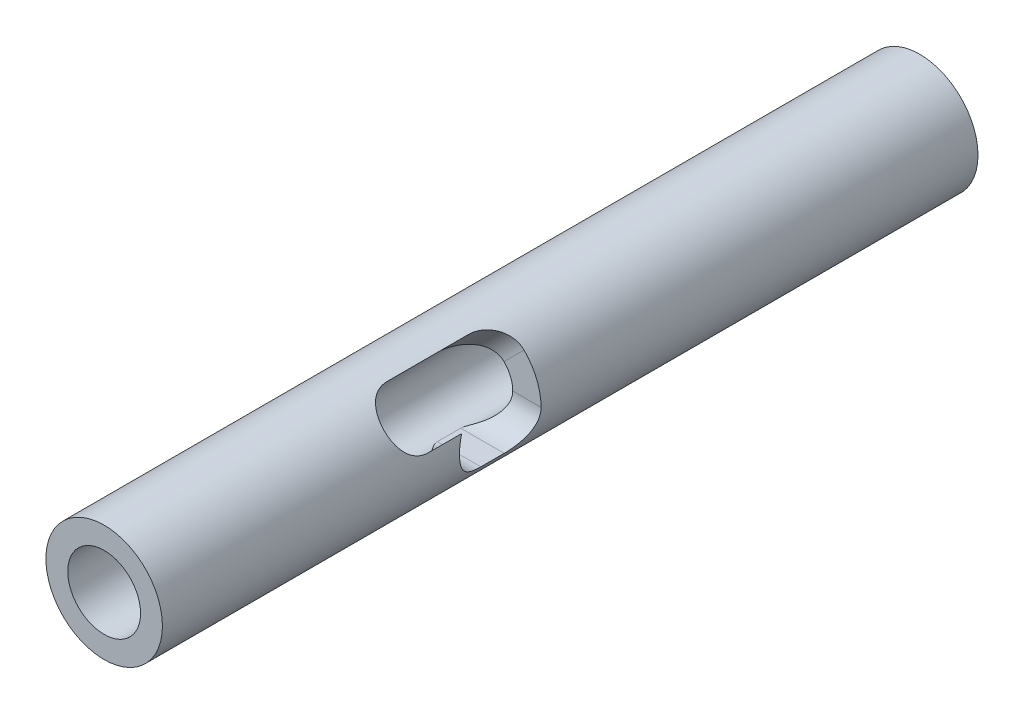
from build123d import *

# Parameters (mm, degrees)
SKETCH1_R           = 6.35
SKETCH1_R_2         = 3.2639
BOSS_EXTRUDE1_DEPTH = 88.9
CUT_EXTRUDE2_DEPTH  = 90.352420225
CUT_EXTRUDE3_DEPTH  = 90.352420338
SKETCH75_W          = 6.35
SKETCH75_H          = 6.35
CUT_REVOLVE1_ANGLE  = 45


# Read off the part's stored shape, not the designer's step: 3/8-16 Tapped Hole3
with BuildPart() as part:
    # Sketch1 → Boss-Extrude1 (new body)
    with BuildSketch(Plane.XY):
        Circle(SKETCH1_R)
        Circle(SKETCH1_R_2, mode=Mode.SUBTRACT)
    extrude(amount=BOSS_EXTRUDE1_DEPTH)

    # 3/8-16 Tapped Hole3 outline → 3/8-16 Tapped Hole3 (revolve, cut)
    with BuildSketch(Plane.XZ):
        Polygon((3.2639, 88.9), (3.2639, 69.426483393), (3.96875, 69.85), (3.96875, 88.9), align=None)
        Polygon((3.96875, 19.05), (3.2639, 19.473516607), (3.2639, 0), (3.96875, 0), align=None)
    revolve(axis=Axis((0, 0, 0), (0, 0, 1)), mode=Mode.SUBTRACT)

    # Sketch13 → Cut-Extrude2 (cut, through all)
    with BuildSketch(Plane(origin=(0, 0, 0), x_dir=(0, 0, -1), z_dir=(1, 0, 0))):
        with BuildLine():
            Line((-50.8, -3.175), (-53.34, -3.175))
            ThreePointArc((-53.34, -3.175), (-56.515, 0), (-53.34, 3.175))
            Line((-53.34, 3.175), (-50.8, 3.175))
            ThreePointArc((-50.8, 3.175), (-47.625, 0), (-50.8, -3.175))
        make_face()
    extrude(amount=CUT_EXTRUDE2_DEPTH, mode=Mode.SUBTRACT)

    # Sketch52 → Cut-Extrude3 (cut, through all)
    with BuildSketch(Plane(origin=(0, 0, 0), x_dir=(0.7071067811865491, -0.7071067811865461, 0), z_dir=(0.7071067811865461, 0.7071067811865491, 0))):
        with BuildLine():
            Line((3.175, -50.8), (3.175, -59.69))
            ThreePointArc((3.175, -59.69), (0, -62.865), (-3.175, -59.69))
            Line((-3.175, -59.69), (-3.175, -50.8))
            ThreePointArc((-3.175, -50.8), (0, -47.625), (3.175, -50.8))
        make_face()
    extrude(amount=CUT_EXTRUDE3_DEPTH, mode=Mode.SUBTRACT)

    # Sketch75 → Cut-Revolve1 (revolve, cut)
    with BuildSketch(Plane(origin=(0, 0, 0), x_dir=(1, 0, 0), z_dir=(0, 1, 0))):
        with Locations((3.175, -50.8)):
            Rectangle(SKETCH75_W, SKETCH75_H)
    revolve(axis=Axis((0, 0, 0), (0, 0, 1)), revolution_arc=CUT_REVOLVE1_ANGLE, mode=Mode.SUBTRACT)


solid = part.part
